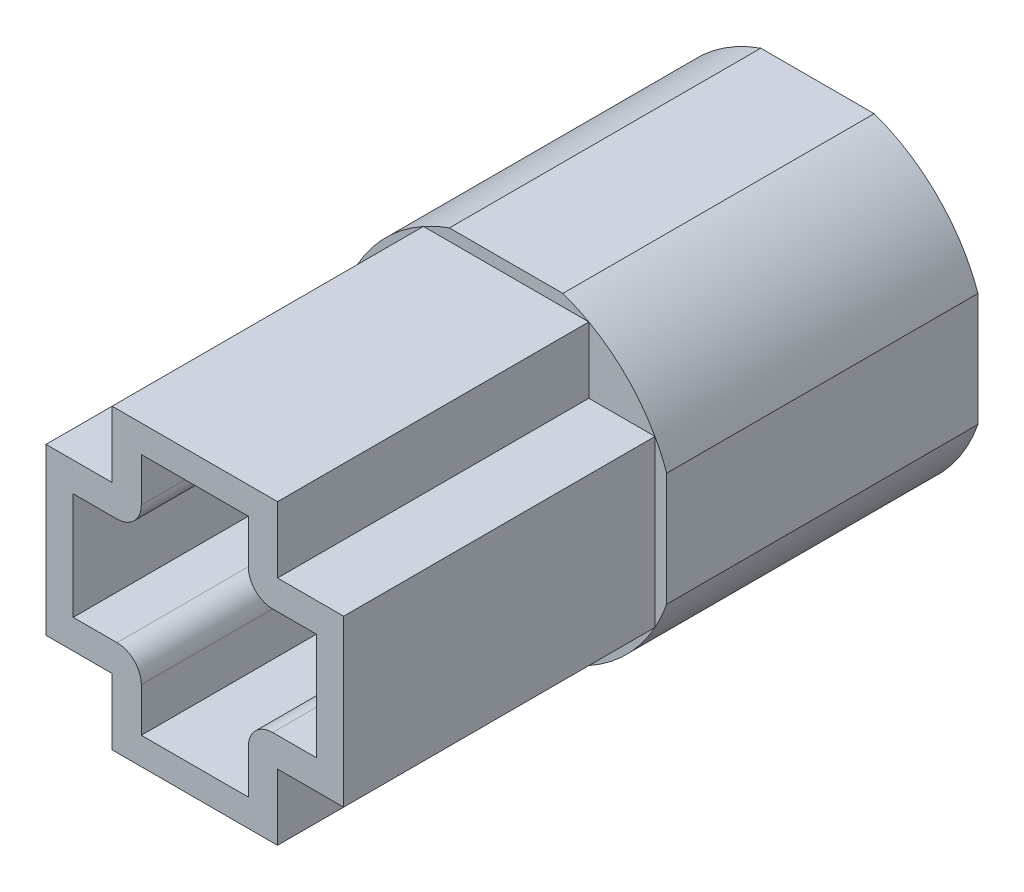
from build123d import *

# Parameters (mm, degrees)
SKETCH1_R           = 3.5
BOSS_EXTRUDE1_DEPTH = 6.4
BOSS_EXTRUDE2_DEPTH = 6.4
SKETCH4_W           = 2.332380758
SKETCH4_H           = 1.506497891
SKETCH4_H_2         = 1.532451386
SKETCH4_W_2         = 1.516078362
SKETCH4_H_3         = 2.332380758
SKETCH4_W_3         = 3.597333618
CUT_EXTRUDE1_DEPTH  = 6.4
CUT_EXTRUDE2_DEPTH  = 6
CUT_EXTRUDE3_DEPTH  = 6
CUT_EXTRUDE4_DEPTH  = 0.8


with BuildPart() as part:
    # Sketch1 → Boss-Extrude1 (new body)
    with BuildSketch(Plane.XY):
        Circle(SKETCH1_R)
    extrude(amount=BOSS_EXTRUDE1_DEPTH)

    # Sketch2 → Boss-Extrude2 (add)
    with BuildSketch(Plane.XY.offset(6.4)):
        Polygon((-1.7, 3.059411708), (-1.7, 1.7), (-3.059411708, 1.7), (-3.059411708, -1.7), (-1.7, -1.7), (-1.7, -3.059411708), (1.7, -3.059411708), (1.7, -1.7), (3.059411708, -1.7), (3.059411708, 1.7), (1.7, 1.7), (1.7, 3.059411708), align=None)
    extrude(amount=BOSS_EXTRUDE2_DEPTH)

    # Sketch4 → Cut-Extrude1 (cut)
    with BuildSketch(Plane(origin=(0, 0, 0), x_dir=(-1, 0, 0), z_dir=(0, 0, -1))):
        with Locations((0, 4.053248946)):
            Rectangle(SKETCH4_W, SKETCH4_H)
        with Locations((0, -4.066225693)):
            Rectangle(SKETCH4_W, SKETCH4_H_2)
        with Locations((-4.058039181, 0)):
            Rectangle(SKETCH4_W_2, SKETCH4_H_3)
        with Locations((5.098666809, 0)):
            Rectangle(SKETCH4_W_3, SKETCH4_H_3)
    extrude(amount=-CUT_EXTRUDE1_DEPTH, mode=Mode.SUBTRACT)

    # Sketch5 → Cut-Extrude2 (cut)
    with BuildSketch(Plane.XY.offset(12.8)):
        with BuildLine():
            Line((-1.1, 2.5), (1.1, 2.5))
            Line((1.1, 2.5), (1.1, 1.6))
            ThreePointArc((1.1, 1.6), (1.246446609, 1.246446609), (1.6, 1.1))
            Line((1.6, 1.1), (2.5, 1.1))
            Line((2.5, 1.1), (2.5, -1.1))
            Line((2.5, -1.1), (1.6, -1.1))
            ThreePointArc((1.6, -1.1), (1.246446609, -1.246446609), (1.1, -1.6))
            Line((1.1, -1.6), (1.1, -2.5))
            Line((1.1, -2.5), (-1.1, -2.5))
            Line((-1.1, -2.5), (-1.1, -1.6))
            ThreePointArc((-1.1, -1.6), (-1.246446609, -1.246446609), (-1.6, -1.1))
            Line((-1.6, -1.1), (-2.5, -1.1))
            Line((-2.5, -1.1), (-2.5, 1.1))
            Line((-2.5, 1.1), (-1.6, 1.1))
            ThreePointArc((-1.6, 1.1), (-1.246446609, 1.246446609), (-1.1, 1.6))
            Line((-1.1, 1.6), (-1.1, 2.5))
        make_face()
    extrude(amount=-CUT_EXTRUDE2_DEPTH, mode=Mode.SUBTRACT)

    # Sketch6 → Cut-Extrude3 (cut)
    with BuildSketch(Plane(origin=(0, 0, 0), x_dir=(-1, 0, 0), z_dir=(0, 0, -1))):
        with BuildLine():
            Line((-1.946150046, -2.15), (1.946150046, -2.15))
            ThreePointArc((1.946150046, -2.15), (2.9, 0), (1.946150046, 2.15))
            Line((1.946150046, 2.15), (-1.946150046, 2.15))
            ThreePointArc((-1.946150046, 2.15), (-2.9, 0), (-1.946150046, -2.15))
        make_face()
    extrude(amount=-CUT_EXTRUDE3_DEPTH, mode=Mode.SUBTRACT)

    # Sketch7 → Cut-Extrude4 (cut)
    with BuildSketch(Plane.XY.offset(6.8)):
        Polygon((-0.6, 2), (-0.6, 0.6), (-2, 0.6), (-2, -0.6), (-0.6, -0.6), (-0.6, -2), (0.6, -2), (0.6, -0.6), (2, -0.6), (2, 0.6), (0.6, 0.6), (0.6, 2), align=None)
    extrude(amount=-CUT_EXTRUDE4_DEPTH, mode=Mode.SUBTRACT)


solid = part.part
